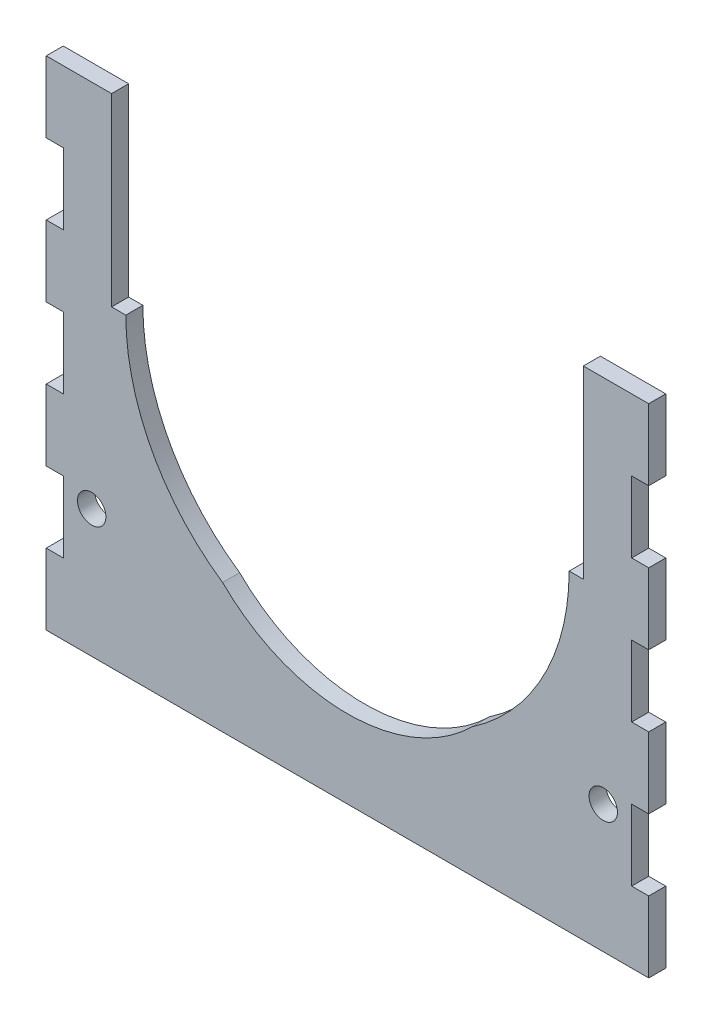
from build123d import *

# Parameters (mm, degrees)
BOSS_EXTRUDE1_DEPTH   = 6
SKETCH2_W             = 6
SKETCH2_H             = 25
BOSS_EXTRUDE2_DEPTH   = 6
LPATTERN1_OUTLINE_W   = 6
LPATTERN1_OUTLINE_H   = 6
LPATTERN1_DEPTH       = 25
LPATTERN1_START       = 50
LPATTERN1_2_OUTLINE_W = 6
LPATTERN1_2_OUTLINE_H = 6
LPATTERN1_2_DEPTH     = 25
LPATTERN1_START_2     = 100
LPATTERN1_3_OUTLINE_W = 6
LPATTERN1_3_OUTLINE_H = 6
LPATTERN1_3_DEPTH     = 25
LPATTERN1_START_3     = 150
LPATTERN1_4_OUTLINE_W = 6
LPATTERN1_4_OUTLINE_H = 6
LPATTERN1_4_DEPTH     = 25
SKETCH5_R             = 5
CUT_EXTRUDE1_DEPTH    = 271.364568685
SKETCH6_W             = 5
SKETCH6_H             = 65
CUT_EXTRUDE2_DEPTH    = 10


# Read off the part's stored shape, not the designer's step: LPattern1
with BuildPart() as part:
    # Sketch1 → Boss-Extrude1 (new body)
    with BuildSketch(Plane.XY):
        with BuildLine():
            Line((-178, 175), (-200, 175))
            Line((-200, 175), (-200, 0))
            Line((-200, 0), (0, 0))
            Line((0, 0), (0, 175))
            Line((0, 175), (-22, 175))
            Line((-22, 175), (-22, 110))
            ThreePointArc((-22, 110), (-31.037807258, 73.555302549), (-56.056819802, 45.55625))
            ThreePointArc((-56.056819802, 45.55625), (-100, 27.5), (-143.943180198, 45.55625))
            ThreePointArc((-143.943180198, 45.55625), (-168.962192742, 73.555302549), (-178, 110))
            Line((-178, 110), (-178, 175))
        make_face()
    extrude(amount=BOSS_EXTRUDE1_DEPTH)

    # Sketch2 → Boss-Extrude2 (add)
    with BuildSketch(Plane.XY.offset(6)):
        with Locations((-203, 162.5)):
            Rectangle(SKETCH2_W, SKETCH2_H)
    extrude(amount=-BOSS_EXTRUDE2_DEPTH)

    # LPattern1 outline → LPattern1 (add)
    with BuildSketch(Plane(origin=(0, 0, 0), x_dir=(1, 0, 0), z_dir=(0, 1, 0))):
        with Locations((-203, -3)):
            Rectangle(LPATTERN1_OUTLINE_W, LPATTERN1_OUTLINE_H)
        with Locations((3, -3)):
            Rectangle(LPATTERN1_OUTLINE_W, LPATTERN1_OUTLINE_H)
    extrude(amount=LPATTERN1_DEPTH)

    # LPattern1 2 outline → LPattern1 2 (add)
    with BuildSketch(Plane(origin=(0, 0, 0), x_dir=(1, 0, 0), z_dir=(0, 1, 0)).offset(LPATTERN1_START)):
        with Locations((-203, -3)):
            Rectangle(LPATTERN1_2_OUTLINE_W, LPATTERN1_2_OUTLINE_H)
        with Locations((3, -3)):
            Rectangle(LPATTERN1_2_OUTLINE_W, LPATTERN1_2_OUTLINE_H)
    extrude(amount=LPATTERN1_2_DEPTH)

    # LPattern1 3 outline → LPattern1 3 (add)
    with BuildSketch(Plane(origin=(0, 0, 0), x_dir=(1, 0, 0), z_dir=(0, 1, 0)).offset(LPATTERN1_START_2)):
        with Locations((-203, -3)):
            Rectangle(LPATTERN1_3_OUTLINE_W, LPATTERN1_3_OUTLINE_H)
        with Locations((3, -3)):
            Rectangle(LPATTERN1_3_OUTLINE_W, LPATTERN1_3_OUTLINE_H)
    extrude(amount=LPATTERN1_3_DEPTH)

    # LPattern1 4 outline → LPattern1 4 (add)
    with BuildSketch(Plane(origin=(0, 0, 0), x_dir=(1, 0, 0), z_dir=(0, 1, 0)).offset(LPATTERN1_START_3)):
        with Locations((3, -3)):
            Rectangle(LPATTERN1_4_OUTLINE_W, LPATTERN1_4_OUTLINE_H)
    extrude(amount=LPATTERN1_4_DEPTH)

    # Sketch5 → Cut-Extrude1 (cut, through all)
    with BuildSketch(Plane.XY.offset(6)):
        with Locations((-10, 45)):
            Circle(SKETCH5_R)
        with Locations(Location((-190, 45, 0), (0, 0, 180))):
            Circle(SKETCH5_R)
    extrude(amount=-CUT_EXTRUDE1_DEPTH, mode=Mode.SUBTRACT)

    # Sketch6 → Cut-Extrude2 (cut)
    with BuildSketch(Plane.XY.offset(6)):
        with Locations((-180.5, 142.5)):
            Rectangle(SKETCH6_W, SKETCH6_H)
        with Locations((-19.5, 142.5)):
            Rectangle(SKETCH6_W, SKETCH6_H)
    extrude(amount=-CUT_EXTRUDE2_DEPTH, mode=Mode.SUBTRACT)


solid = part.part
